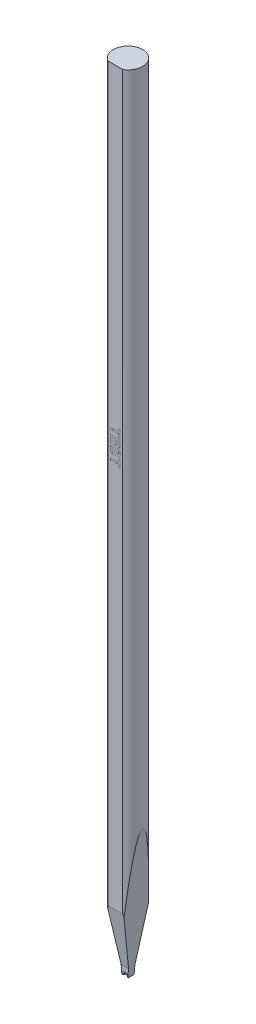
from build123d import *

# Parameters (mm, degrees)
SKETCH_TL_CUTTING_R       = 1.4986
TL_CUTTING_DEPTH          = 81.28
SKETCH_TDF_GRINDING_W     = 3.0172
SKETCH_TDF_GRINDING_H     = 3.0172
TDF_GRINDING_DEPTH        = 82.307625743
ENGRAVING_DEPTH           = 0.005
VW_VR_GRINDING_DEPTH      = 1.5086
VW_VR_GRINDING_DEPTH_BACK = 1.5086
ISA_GRINDING_DEPTH        = 1.5086
ISA_GRINDING_DEPTH_BACK   = 1.5086
PRE_FRX_BRX_DEPTH         = 1.5086
PRE_FRX_BRX_DEPTH_BACK    = 1.5086
SKETCH_PRE_FRX_BRX_W      = 1.18348
SKETCH_PRE_FRX_BRX_H      = 0.889
FR_EDM_R                  = 0.22606
BR_EDM_R                  = 0.22606
FA_BA_GRINDING_DEPTH      = 1.5086
FA_BA_GRINDING_DEPTH_BACK = 1.5086


with BuildPart() as part:
    # sketch_TL_cutting → TL_cutting (new body)
    with BuildSketch(Plane(origin=(0, 0, 0), x_dir=(1, 0, 0), z_dir=(0, 1, 0))):
        Circle(SKETCH_TL_CUTTING_R)
    extrude(amount=TL_CUTTING_DEPTH)

    # sketch_TDF_grinding → TDF_grinding (cut, through all)
    with BuildSketch(Plane(origin=(0, 0, 0), x_dir=(1, 0, 0), z_dir=(0, 1, 0))):
        with Locations((0, -2.804)):
            Rectangle(SKETCH_TDF_GRINDING_W, SKETCH_TDF_GRINDING_H)
    extrude(amount=TDF_GRINDING_DEPTH, mode=Mode.SUBTRACT)

    # sketch_engraving → engraving (cut)
    with BuildSketch(Plane.XY.offset(1.2954)):
        Polygon((-0.5, 48.946666667), (0.333333333, 48.946666667), (0.333333333, 49.241538462), (0.5, 49.241538462), (0.5, 48.459487179), (0.333333333, 48.459487179), (0.333333333, 48.754358974), (-0.5, 48.754358974), align=None)
        Polygon((-0.5, 48.331282051), (0.5, 48.331282051), (0.5, 47.587692308), (0.333333333, 47.587692308), (0.333333333, 48.138974359), (0.115384615, 48.138974359), (0.115384615, 47.626153846), (-0.051282051, 47.626153846), (-0.051282051, 48.138974359), (-0.333333333, 48.138974359), (-0.333333333, 47.574871795), (-0.5, 47.574871795), align=None)
        with BuildLine():
            Line((-0.166666667, 47.459487179), (-0.153846154, 47.267179487))
            add(Edge.make_bspline(
                [(-0.153846154, 47.267179487), (-0.161891279, 47.265646838), (-0.177518424, 47.262669765), (-0.199795017, 47.256065855), (-0.220541784, 47.248759687), (-0.239662803, 47.24014681), (-0.25710555, 47.230281742), (-0.273156714, 47.219491464), (-0.28732832, 47.207248708), (-0.299925293, 47.193917022), (-0.310783278, 47.179343845), (-0.320246275, 47.163643245), (-0.328256178, 47.146721977), (-0.334922245, 47.128644665), (-0.339885492, 47.109231253), (-0.343420115, 47.088663609), (-0.345682646, 47.066908608), (-0.345994208, 47.052040942), (-0.346153846, 47.044423077)],
                knots=[0, 0, 0, 0, 1.20477517, 2.340199137, 3.415898527, 4.440826703, 5.422227366, 6.362763262, 7.28278988, 8.172822029, 9.057410505, 9.952475558, 10.866920142, 11.809098, 12.784128911, 13.811833846, 14.878831738, 16, 16, 16, 16], degree=3))
            add(Edge.make_bspline(
                [(-0.346153846, 47.044423077), (-0.346066367, 47.036404779), (-0.345896216, 47.020808776), (-0.343785338, 46.998208443), (-0.340761278, 46.977076105), (-0.335974263, 46.957598368), (-0.330620744, 46.939411504), (-0.323296559, 46.922967199), (-0.314849171, 46.907999345), (-0.305263574, 46.894546503), (-0.294632459, 46.882806195), (-0.28353392, 46.872535187), (-0.272207737, 46.863589818), (-0.260151301, 46.85654918), (-0.247852227, 46.850851285), (-0.234943611, 46.847085376), (-0.221721863, 46.844541282), (-0.212685699, 46.844249548), (-0.208133013, 46.844102564)],
                knots=[0, 0, 0, 0, 1.417779877, 2.757654889, 4.012140507, 5.189587551, 6.302846416, 7.360586765, 8.365575446, 9.33904572, 10.275781718, 11.161696098, 12.012180333, 12.822428111, 13.625933072, 14.403138519, 15.195454004, 16, 16, 16, 16], degree=3))
            add(Edge.make_bspline(
                [(-0.208133013, 46.844102564), (-0.202439146, 46.844396842), (-0.191320796, 46.844971475), (-0.175220679, 46.848741774), (-0.160658688, 46.855546278), (-0.147071392, 46.864782817), (-0.134926522, 46.877747215), (-0.123459543, 46.89415137), (-0.11316916, 46.914611084), (-0.107424402, 46.929779688), (-0.104366987, 46.937852564)],
                knots=[0, 0, 0, 0, 0.906150226, 1.7694295, 2.610923838, 3.450874087, 4.367551936, 5.419872502, 6.626831617, 8, 8, 8, 8], degree=3))
            add(Edge.make_bspline(
                [(-0.104366987, 46.937852564), (-0.103205903, 46.941316751), (-0.100607587, 46.94906904), (-0.096897182, 46.962295), (-0.092218385, 46.978280402), (-0.087052561, 46.997173825), (-0.081545375, 47.018936731), (-0.074955523, 47.043362379), (-0.068334023, 47.070821678), (-0.063456004, 47.090034741), (-0.060897436, 47.100112179)],
                knots=[0, 0, 0, 0, 0.521824192, 1.167757792, 1.961731518, 2.901193269, 3.965386864, 5.168422915, 6.514810244, 8, 8, 8, 8], degree=3))
            add(Edge.make_bspline(
                [(-0.060897436, 47.100112179), (-0.0576208, 47.113235696), (-0.051299067, 47.138555374), (-0.040053153, 47.174667033), (-0.028879714, 47.207926531), (-0.016755933, 47.238013634), (-0.004503472, 47.265260214), (0.008737874, 47.28922555), (0.022280434, 47.310409746), (0.032402475, 47.322754268), (0.037259615, 47.328677885)],
                knots=[0, 0, 0, 0, 1.293880989, 2.496331788, 3.617634808, 4.64976062, 5.598842568, 6.473791081, 7.267636666, 8, 8, 8, 8], degree=3))
            add(Edge.make_bspline(
                [(0.037259615, 47.328677885), (0.044137694, 47.336023939), (0.057622804, 47.350426557), (0.079781426, 47.369385368), (0.103188466, 47.385315932), (0.127671148, 47.39842853), (0.153370416, 47.408524983), (0.180114252, 47.415681219), (0.207972454, 47.420312995), (0.22694455, 47.420785635), (0.236578526, 47.421025641)],
                knots=[0, 0, 0, 0, 1.064429417, 2.086912298, 3.078678339, 4.055528992, 5.020032834, 5.993708893, 6.981211098, 8, 8, 8, 8], degree=3))
            add(Edge.make_bspline(
                [(0.236578526, 47.421025641), (0.249044725, 47.420558178), (0.273773943, 47.41963087), (0.310123415, 47.411128516), (0.34519423, 47.397880126), (0.373053378, 47.382527737), (0.394102454, 47.367749212), (0.409316468, 47.355522559), (0.423234984, 47.341832745), (0.436363342, 47.327171315), (0.448421192, 47.311292179), (0.459337354, 47.294175805), (0.469762031, 47.276144051), (0.481724432, 47.249831674), (0.494501972, 47.214300806), (0.505216674, 47.168065757), (0.511620444, 47.117719983), (0.512410831, 47.082770721), (0.512820513, 47.064655449)],
                knots=[0, 0, 0, 0, 1.180224575, 2.341213254, 3.519178081, 4.726056898, 5.344182394, 5.956118988, 6.573855441, 7.192564044, 7.82049682, 8.461345463, 9.116141012, 9.79299132, 11.198532007, 12.687823846, 14.283197644, 16, 16, 16, 16], degree=3))
            add(Edge.make_bspline(
                [(0.512820513, 47.064655449), (0.512622915, 47.049822415), (0.512238592, 47.02097248), (0.508327094, 46.979154507), (0.502300976, 46.940146167), (0.493471523, 46.904011321), (0.482080613, 46.870681933), (0.468307987, 46.84009305), (0.4520288, 46.812325051), (0.433078398, 46.787673078), (0.412189308, 46.76570984), (0.389371716, 46.746550603), (0.364914548, 46.73012187), (0.338835479, 46.716317679), (0.311000478, 46.70547728), (0.281444264, 46.697515436), (0.250236407, 46.692249404), (0.228852471, 46.690929457), (0.217948718, 46.69025641)],
                knots=[0, 0, 0, 0, 1.325136797, 2.577362738, 3.74962816, 4.849499017, 5.896771726, 6.892816139, 7.842473141, 8.766187929, 9.665133525, 10.546015357, 11.42313021, 12.293255665, 13.177485873, 14.086514152, 15.024305989, 16, 16, 16, 16], degree=3))
            Line((0.217948718, 46.69025641), (0.205128205, 46.882564103))
            add(Edge.make_bspline(
                [(0.205128205, 46.882564103), (0.211158714, 46.883673027), (0.22291155, 46.885834207), (0.239739753, 46.890541314), (0.255319488, 46.895822081), (0.269550394, 46.902088391), (0.282452554, 46.909306722), (0.29405422, 46.917510903), (0.304442868, 46.926546774), (0.313348905, 46.936795242), (0.321255295, 46.948019416), (0.327770309, 46.960645904), (0.333732615, 46.97428403), (0.338229411, 46.989445002), (0.341791978, 47.005853856), (0.344434282, 47.023515385), (0.34572413, 47.042467598), (0.346007328, 47.055505964), (0.346153846, 47.062251603)],
                knots=[0, 0, 0, 0, 1.150775252, 2.242741279, 3.277646382, 4.23752694, 5.158201782, 6.048759188, 6.901533576, 7.736611693, 8.592238639, 9.472855288, 10.399741491, 11.383322377, 12.435924598, 13.551250831, 14.733094547, 16, 16, 16, 16], degree=3))
            add(Edge.make_bspline(
                [(0.346153846, 47.062251603), (0.346024502, 47.06926523), (0.345772856, 47.082910555), (0.344228543, 47.102795431), (0.34137789, 47.121448937), (0.337667048, 47.138962684), (0.332618703, 47.15531328), (0.326463073, 47.170466219), (0.319216002, 47.184490828), (0.313514257, 47.193042422), (0.310697115, 47.197267628)],
                knots=[0, 0, 0, 0, 1.186678824, 2.308736671, 3.37120409, 4.377216403, 5.334874112, 6.262130804, 7.141346615, 8, 8, 8, 8], degree=3))
            add(Edge.make_bspline(
                [(0.310697115, 47.197267628), (0.30684882, 47.202103022), (0.299395868, 47.211467679), (0.284596838, 47.221546031), (0.267881777, 47.227613222), (0.256061421, 47.228343477), (0.25, 47.228717949)],
                knots=[0, 0, 0, 0, 1.037857257, 2.010007357, 2.979541333, 4, 4, 4, 4], degree=3))
            add(Edge.make_bspline(
                [(0.25, 47.228717949), (0.244335199, 47.228411699), (0.233176443, 47.227808437), (0.217325189, 47.221723758), (0.202637862, 47.212366351), (0.194659513, 47.203623389), (0.190504808, 47.199070513)],
                knots=[0, 0, 0, 0, 0.98538058, 1.941042925, 2.927803204, 4, 4, 4, 4], degree=3))
            add(Edge.make_bspline(
                [(0.190504808, 47.199070513), (0.187808196, 47.195457219), (0.18178239, 47.187383012), (0.17412302, 47.172592664), (0.165827461, 47.154740327), (0.157717635, 47.133419009), (0.149622864, 47.108770412), (0.141170987, 47.080793037), (0.132605635, 47.049469676), (0.124310512, 47.015598747), (0.116156882, 46.981210215), (0.107242663, 46.948394186), (0.098551989, 46.917879998), (0.089442753, 46.889809137), (0.080574939, 46.864036902), (0.071467056, 46.840688486), (0.062596997, 46.819603571), (0.050400038, 46.795016221), (0.033878763, 46.767148934), (0.009862335, 46.737940873), (-0.017133698, 46.71211007), (-0.042589095, 46.694111853), (-0.064481415, 46.68174802), (-0.081932142, 46.673787016), (-0.100320809, 46.666900123), (-0.119667735, 46.661294211), (-0.140000145, 46.657231274), (-0.161162698, 46.653868957), (-0.183331155, 46.652151086), (-0.198448465, 46.651914888), (-0.206129808, 46.651794872)],
                knots=[0, 0, 0, 0, 0.511875881, 1.143829537, 1.88775736, 2.750598373, 3.734912702, 4.837306479, 6.073130119, 7.42648979, 8.801963576, 10.091065733, 11.292408984, 12.408830014, 13.446061236, 14.39066453, 15.257936293, 16.045629259, 17.510392066, 18.929669597, 20.331293837, 21.746891395, 22.460690638, 23.187651344, 23.925159671, 24.69163991, 25.474819891, 26.281170188, 27.126635539, 28, 28, 28, 28], degree=3))
            add(Edge.make_bspline(
                [(-0.206129808, 46.651794872), (-0.213213723, 46.651959898), (-0.227281693, 46.652287624), (-0.248162112, 46.65457786), (-0.268671734, 46.658119654), (-0.288836268, 46.663362726), (-0.308616053, 46.670318192), (-0.328296541, 46.67814951), (-0.347448635, 46.687942071), (-0.366087841, 46.699087568), (-0.384201522, 46.711380711), (-0.400907086, 46.725314284), (-0.416780552, 46.740055612), (-0.430830184, 46.756560723), (-0.444499814, 46.773643959), (-0.456413626, 46.792420246), (-0.467267368, 46.8122888), (-0.476944445, 46.833430724), (-0.485241283, 46.855916056), (-0.492760445, 46.879609726), (-0.498861937, 46.904735261), (-0.504102567, 46.931122199), (-0.508085093, 46.958872973), (-0.510866581, 46.987951218), (-0.512434986, 47.01836402), (-0.512690407, 47.03907945), (-0.512820513, 47.04963141)],
                knots=[0, 0, 0, 0, 0.900523777, 1.788352984, 2.667658312, 3.544829998, 4.433470602, 5.332071549, 6.235671317, 7.16456001, 8.092361829, 9.015217829, 9.927983376, 10.842405559, 11.767913001, 12.707486241, 13.664840466, 14.644960138, 15.660436429, 16.710285012, 17.80361473, 18.945755434, 20.129541241, 21.366238063, 22.658422763, 24, 24, 24, 24], degree=3))
            add(Edge.make_bspline(
                [(-0.512820513, 47.04963141), (-0.512571769, 47.064866814), (-0.512087459, 47.094530507), (-0.507752501, 47.137626527), (-0.501117535, 47.178047736), (-0.491487967, 47.215728351), (-0.47912575, 47.250714363), (-0.463898318, 47.282990034), (-0.445714308, 47.31239848), (-0.4250161, 47.339306724), (-0.401421388, 47.363346069), (-0.37543806, 47.384991703), (-0.346733609, 47.40382454), (-0.315676999, 47.420354557), (-0.28185988, 47.433843417), (-0.245840091, 47.445371406), (-0.207125792, 47.45394819), (-0.180386288, 47.457608917), (-0.166666667, 47.459487179)],
                knots=[0, 0, 0, 0, 1.217919187, 2.371317543, 3.459749122, 4.490553404, 5.476795534, 6.422548752, 7.338285933, 8.236452553, 9.131296239, 10.026155855, 10.935394819, 11.871650654, 12.834387429, 13.842485342, 14.893012909, 16, 16, 16, 16], degree=3))
        make_face()
        Polygon((-0.5, 46.254358974), (0.333333333, 46.254358974), (0.333333333, 46.549230769), (0.5, 46.549230769), (0.5, 45.767179487), (0.333333333, 45.767179487), (0.333333333, 46.062051282), (-0.5, 46.062051282), align=None)
    extrude(amount=-ENGRAVING_DEPTH, mode=Mode.SUBTRACT)

    # sketch_VW_VR_grinding → VW_VR_grinding (cut, two sides: drawn at the far end of the back side and taken through both)
    with BuildSketch(Plane.XY.offset(-VW_VR_GRINDING_DEPTH_BACK)):
        with BuildLine():
            Line((-1.4936, -0.01), (-1.4936, 0.874))
            ThreePointArc((-1.4936, 0.874), (-1.495064466, 0.877535534), (-1.4986, 0.879))
            Line((-1.4986, 0.879), (-1.5086, 0.879))
            Line((-1.5086, 0.879), (-1.5086, -0.01))
            Line((-1.5086, -0.01), (-1.4936, -0.01))
        make_face()
        with BuildLine():
            Line((1.4936, -0.01), (1.4936, 0.874))
            ThreePointArc((1.4936, 0.874), (1.495064466, 0.877535534), (1.4986, 0.879))
            Line((1.4986, 0.879), (1.5086, 0.879))
            Line((1.5086, 0.879), (1.5086, -0.01))
            Line((1.5086, -0.01), (1.4936, -0.01))
        make_face()
    extrude(amount=VW_VR_GRINDING_DEPTH + VW_VR_GRINDING_DEPTH_BACK, mode=Mode.SUBTRACT)

    # sketch_ISA_grinding → ISA_grinding (cut, two sides: drawn at the far end of the back side and taken through both)
    with BuildSketch(Plane.XY.offset(-ISA_GRINDING_DEPTH_BACK)):
        Polygon((-0.29972, 0), (-1.5086, 13.817561628), (-1.5086, -0.01), (1.5086, -0.01), (1.5086, 13.817561628), (0.29972, 0), align=None)
    extrude(amount=ISA_GRINDING_DEPTH + ISA_GRINDING_DEPTH_BACK, mode=Mode.SUBTRACT)

    # sketch_pre_FRX_BRX → pre_FRX_BRX (cut, two sides: drawn at the far end of the back side and taken through both)
    with BuildSketch(Plane(origin=(0, 0, 0), x_dir=(0, 0, -1), z_dir=(1, 0, 0)).offset(-PRE_FRX_BRX_DEPTH_BACK)):
        with Locations((-0.91686, 0.4345)):
            Rectangle(SKETCH_PRE_FRX_BRX_W, SKETCH_PRE_FRX_BRX_H)
        with Locations((0.91686, 0.4345)):
            Rectangle(SKETCH_PRE_FRX_BRX_W, SKETCH_PRE_FRX_BRX_H)
    extrude(amount=PRE_FRX_BRX_DEPTH + PRE_FRX_BRX_DEPTH_BACK, mode=Mode.SUBTRACT)

    # V-Groove_EDM: sweep along a path in sketch_contour_V-Groove
    with BuildLine(Plane(origin=(0, 0, 0), x_dir=(0, 0, -1), z_dir=(1, 0, 0))) as v_groove_edm_path:
        Line((-1.2954, 0.1905), (0, 0.1905))
        Line((0, 0.1905), (1.4986, 0.1905))
    # sketch_section_V-Groove → V-Groove_EDM (sweep, cut)
    with BuildSketch(Plane.XY.offset(1.2954)):
        with BuildLine():
            Line((-1.49899536, -1.905), (-0.049898839, 0.164524309))
            ThreePointArc((-0.049898839, 0.164524309), (0, 0.1905), (0.049898839, 0.164524309))
            Line((0.049898839, 0.164524309), (1.49899536, -1.905))
            Line((1.49899536, -1.905), (-1.49899536, -1.905))
        make_face()
    sweep(path=v_groove_edm_path.line, mode=Mode.SUBTRACT)

    # FR_EDM
    fr_edm_edges = [part.edges().sort_by_distance(p)[0] for p in [
        (0.107499419, 0.082262154, 0.32512),
        (0, 0.1905, 0.32512),
        (-0.107499419, 0.082262154, 0.32512),
    ]]
    fillet(fr_edm_edges, radius=FR_EDM_R)

    # BR_EDM
    br_edm_edges = [part.edges().sort_by_distance(p)[0] for p in [
        (0.107499419, 0.082262154, -0.32512),
        (0, 0.1905, -0.32512),
        (-0.107499419, 0.082262154, -0.32512),
    ]]
    fillet(br_edm_edges, radius=BR_EDM_R)

    # sketch_FA_BA_grinding → FA_BA_grinding (cut, two sides: drawn at the far end of the back side and taken through both)
    with BuildSketch(Plane(origin=(0, 0, 0), x_dir=(0, 0, -1), z_dir=(1, 0, 0)).offset(-FA_BA_GRINDING_DEPTH_BACK)):
        Polygon((2.4986, 13.215417609), (2.4986, -0.1), (0.32512, -0.1), (0.32512, 0.889), align=None)
        Polygon((-4.003016323, 21.747386554), (-0.32512, 0.889), (-0.32512, -0.1), (-4.003016323, -0.1), align=None)
    extrude(amount=FA_BA_GRINDING_DEPTH + FA_BA_GRINDING_DEPTH_BACK, mode=Mode.SUBTRACT)


solid = part.part
